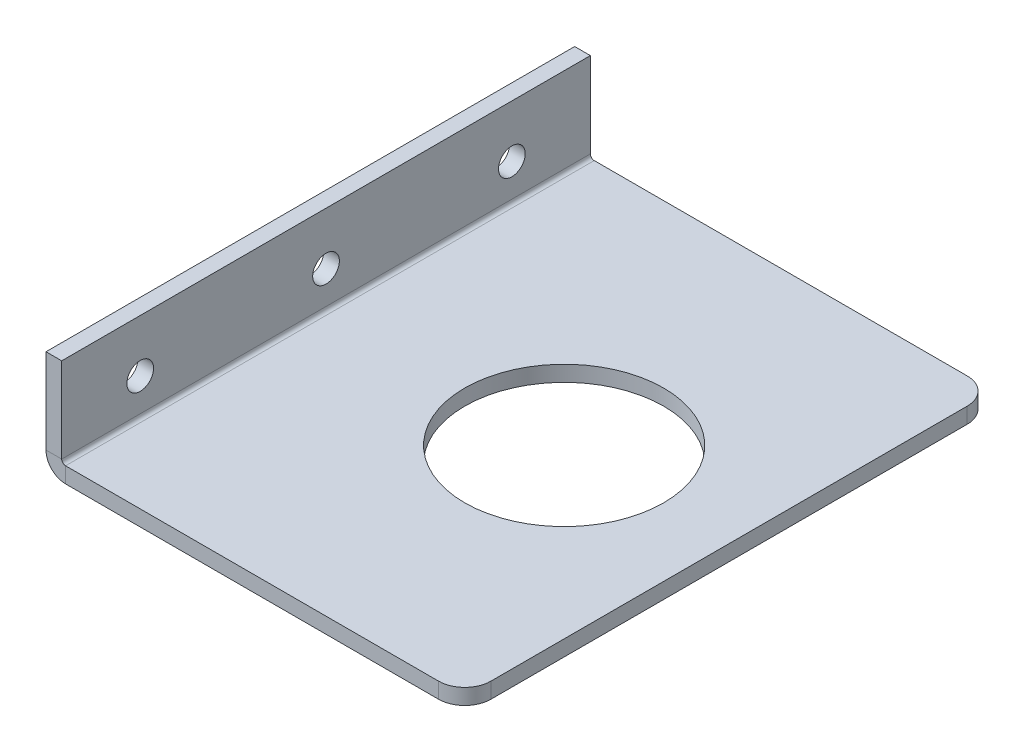
from build123d import *

# Parameters (mm, degrees)
BASE_FLANGE1_DEPTH      = 100
BASE_FLANGE1_DEPTH_BACK = 1
FILLET1_R               = 5
CUT_EXTRUDE1_REACH      = 131.186
SKETCH2_R               = 19
CUT_EXTRUDE2_REACH      = 131.615
SKETCH3_R               = 2.55


# Sheet-metal steps are written as plain solids
with BuildPart() as part:
    # Sketch1 → Base-Flange1 (new, two sides: drawn at the far end of the back side and taken through both)
    with BuildSketch(Plane.XY.offset(-BASE_FLANGE1_DEPTH_BACK)):
        with BuildLine():
            Line((0, 20), (0, 3.7366))
            ThreePointArc((0, 3.7366), (1.094424801, 1.094424801), (3.7366, 0))
            Line((3.7366, 0), (80, 0))
            Line((80, 0), (80, 3))
            Line((80, 3), (3.7366, 3))
            ThreePointArc((3.7366, 3), (3.215745145, 3.215745145), (3, 3.7366))
            Line((3, 3.7366), (3, 20))
            Line((3, 20), (0, 20))
        make_face()
    extrude(amount=BASE_FLANGE1_DEPTH + BASE_FLANGE1_DEPTH_BACK)

    # Fillet1
    fillet1_edges = [part.edges().sort_by_distance(p)[0] for p in [
        (80, 1.5, -1),
        (80, 1.5, 100),
    ]]
    fillet(fillet1_edges, radius=FILLET1_R)

    # Sketch2 → Cut-Extrude1 (cut, up to next)
    with BuildSketch(Plane(origin=(0, 3, 0), x_dir=(1, 0, 0), z_dir=(0, 1, 0)), mode=Mode.PRIVATE) as cut_extrude1_sk1:
        with Locations(Location((48, -49, 0), (0, 0, 270))):
            Circle(SKETCH2_R)
    cut_extrude1_tool1 = extrude(cut_extrude1_sk1.sketch, amount=-CUT_EXTRUDE1_REACH, mode=Mode.PRIVATE) & part.part
    add(cut_extrude1_tool1.solids().sort_by_distance((48, 3, 49))[0], mode=Mode.SUBTRACT)

    # Sketch3 → Cut-Extrude2 (cut, up to next)
    with BuildSketch(Plane.ZY, mode=Mode.PRIVATE) as cut_extrude2_sk1:
        with Locations((14, 10)):
            Circle(SKETCH3_R)
    cut_extrude2_tool1 = extrude(cut_extrude2_sk1.sketch, amount=-CUT_EXTRUDE2_REACH, mode=Mode.PRIVATE) & part.part
    # Sketch3 → Cut-Extrude2 (cut, up to next)
    with BuildSketch(Plane.ZY, mode=Mode.PRIVATE) as cut_extrude2_sk2:
        with Locations((49.5, 10)):
            Circle(SKETCH3_R)
    cut_extrude2_tool2 = extrude(cut_extrude2_sk2.sketch, amount=-CUT_EXTRUDE2_REACH, mode=Mode.PRIVATE) & part.part
    # Sketch3 → Cut-Extrude2 (cut, up to next)
    with BuildSketch(Plane.ZY, mode=Mode.PRIVATE) as cut_extrude2_sk3:
        with Locations((85, 10)):
            Circle(SKETCH3_R)
    cut_extrude2_tool3 = extrude(cut_extrude2_sk3.sketch, amount=-CUT_EXTRUDE2_REACH, mode=Mode.PRIVATE) & part.part
    add(cut_extrude2_tool1.solids().sort_by_distance((0, 10, 14))[0], mode=Mode.SUBTRACT)
    add(cut_extrude2_tool2.solids().sort_by_distance((0, 10, 49.5))[0], mode=Mode.SUBTRACT)
    add(cut_extrude2_tool3.solids().sort_by_distance((0, 10, 85))[0], mode=Mode.SUBTRACT)


solid = part.part
